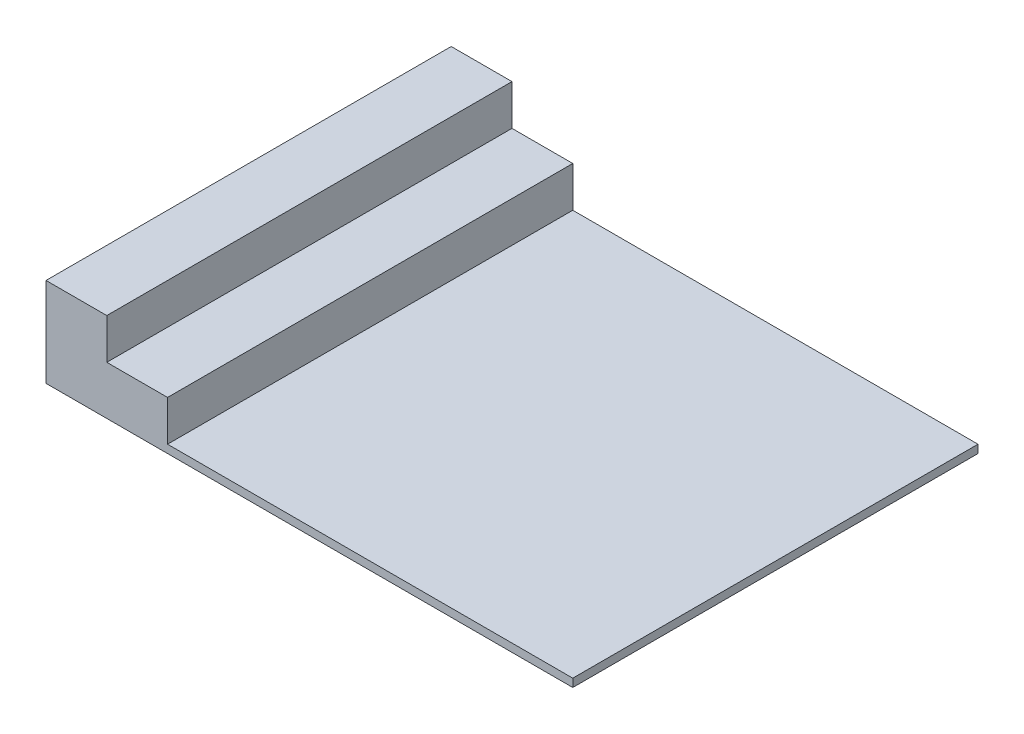
from build123d import *

# Parameters (mm, degrees)
RESSALTO_EXTRUS_O1_DEPTH = 1000


with BuildPart() as part:
    # Esboço1 → Ressalto-extrusão1 (new body)
    with BuildSketch(Plane.XY):
        Polygon((223.489698949, -121.483516484), (-776.510301051, -121.483516484), (-776.510301051, -21.483516484), (-926.510301051, -21.483516484), (-926.510301051, 78.516483516), (-1076.510301051, 78.516483516), (-1076.510301051, -141.483516484), (-840.246564787, -141.483516484), (223.489698949, -141.483516484), align=None)
    extrude(amount=RESSALTO_EXTRUS_O1_DEPTH)


solid = part.part
